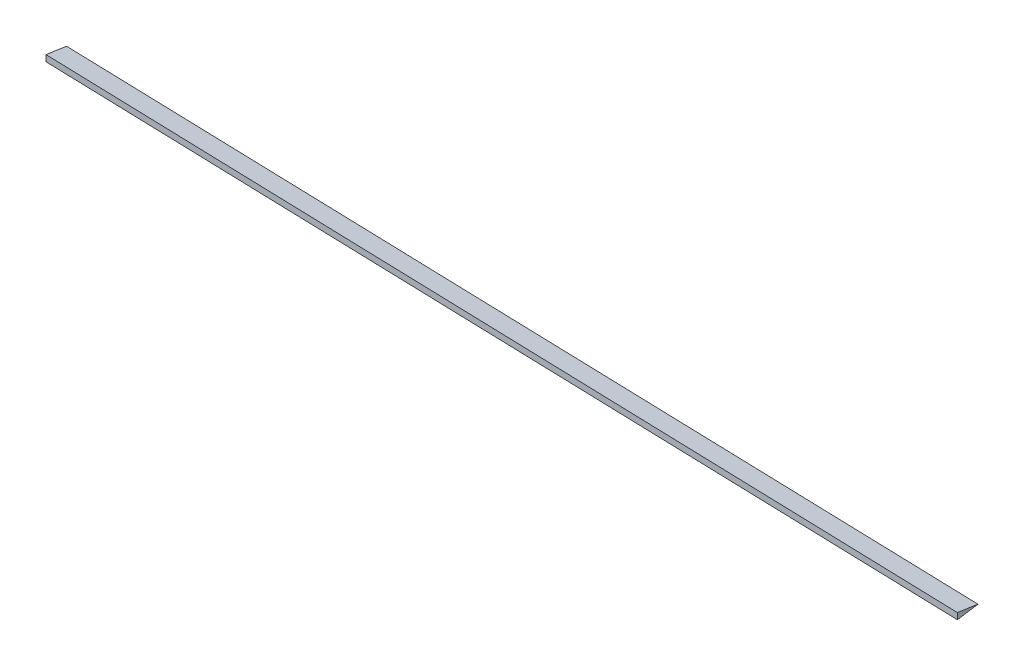
from build123d import *

# Parameters (mm, degrees)
AILERON_DEPTH = 1363.503192973


with BuildPart() as part:
    # aileron_root → aileron (new, along a direction that is not the sketch's normal)
    with BuildSketch(Plane(origin=(0, 0, 0), x_dir=(0, 0, -1), z_dir=(1, 0, 0))):
        Polygon((-30, -4.531071341), (-30, 4.531071341), (0, 0), align=None)
    extrude(amount=AILERON_DEPTH, dir=(0.999569601115616, 0, 0.02933619821259179))


solid = part.part
